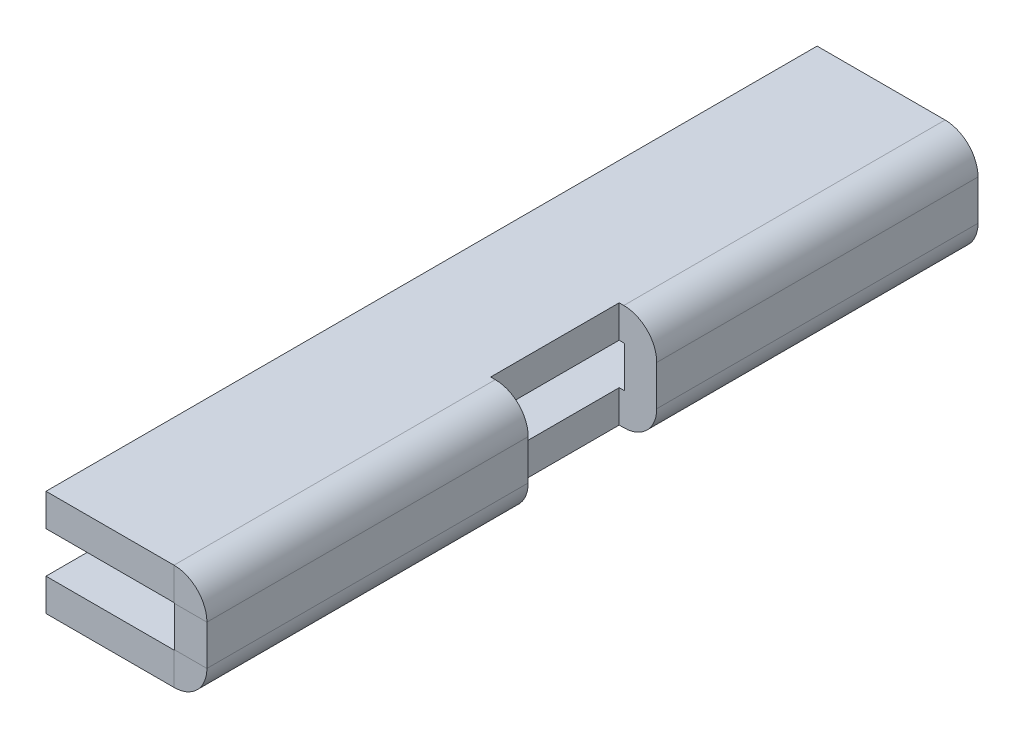
from build123d import *

# Parameters (mm, degrees)
BOSS_EXTRUDE1_DEPTH    = 19.05
CONVERT_SOLID1_START   = -19.05
CONVERT_SOLID1_DEPTH   = 38.1
CONVERT_SOLID1_2_DEPTH = 38.1
SKETCH2_W              = 1.8542
SKETCH2_H              = 5.2324
CUT_EXTRUDE1_DEPTH     = 3.175


# Read off the part's stored shape, not the designer's step: SharpBend1
with BuildPart() as part:
    # Sketch1 → Boss-Extrude1 (new, symmetric)
    with BuildSketch(Plane(origin=(0, 0, 0), x_dir=(1, 0, 0), z_dir=(0, 0, -1))):
        Polygon((1.6002, -2.6162), (-6.35, -2.6162), (-6.35, -1.016), (0, -1.016), (0, 1.016), (-6.35, 1.016), (-6.35, 2.6162), (1.6002, 2.6162), align=None)
    extrude(amount=BOSS_EXTRUDE1_DEPTH, both=True)

    # Convert-Solid1 outline → Convert-Solid1 (cut)
    with BuildSketch(Plane.XY.offset(CONVERT_SOLID1_START)):
        with BuildLine():
            Line((1.6002, -2.6162), (1.6002, -0.9906))
            ThreePointArc((1.6002, -0.9906), (1.124072783, -2.140072783), (-0.0254, -2.6162))
            Line((-0.0254, -2.6162), (1.6002, -2.6162))
        make_face()
        with BuildLine():
            ThreePointArc((-0.0254, 2.6162), (1.124072783, 2.140072783), (1.6002, 0.9906))
            Line((1.6002, 0.9906), (1.6002, 2.6162))
            Line((1.6002, 2.6162), (-0.0254, 2.6162))
        make_face()
    extrude(amount=CONVERT_SOLID1_DEPTH, mode=Mode.SUBTRACT)

    # Convert-Solid1 2 outline → Convert-Solid1 2 (add)
    with BuildSketch(Plane.XY.offset(CONVERT_SOLID1_START)):
        with BuildLine():
            Line((0, -1.016), (0, -0.9906))
            ThreePointArc((0, -0.9906), (-0.007439488, -1.008560512), (-0.0254, -1.016))
            Line((-0.0254, -1.016), (0, -1.016))
        make_face()
        with BuildLine():
            ThreePointArc((-0.0254, 1.016), (-0.007439488, 1.008560512), (0, 0.9906))
            Line((0, 0.9906), (0, 1.016))
            Line((0, 1.016), (-0.0254, 1.016))
        make_face()
    extrude(amount=CONVERT_SOLID1_2_DEPTH)

    # Sketch2 → Cut-Extrude1 (cut, symmetric)
    with BuildSketch(Plane.XY):
        with Locations((0.6731, 0)):
            Rectangle(SKETCH2_W, SKETCH2_H)
    extrude(amount=CUT_EXTRUDE1_DEPTH, both=True, mode=Mode.SUBTRACT)


solid = part.part
